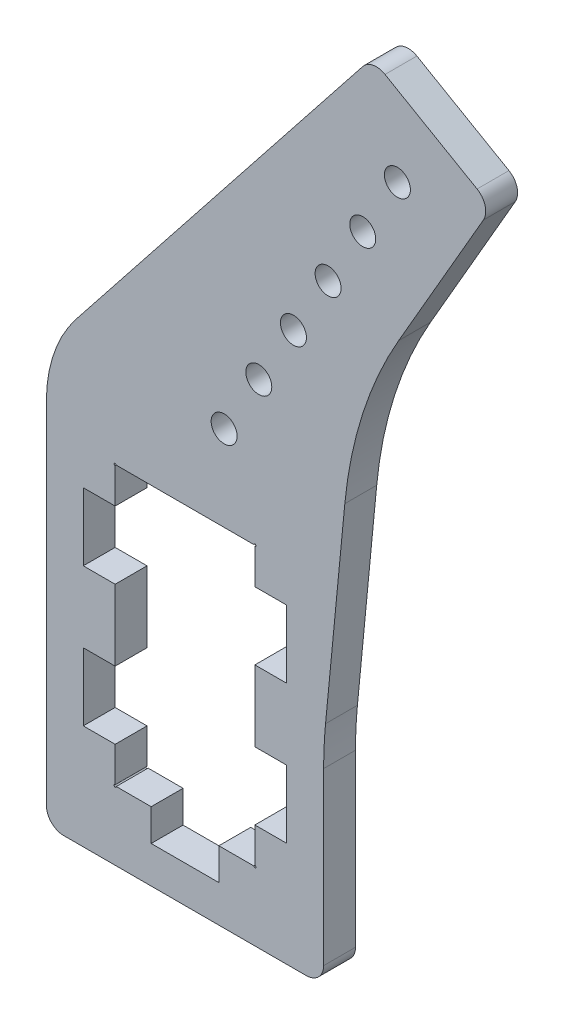
from build123d import *

# Parameters (mm, degrees)
SKETCH1_R           = 2.38125
BOSS_EXTRUDE1_DEPTH = 5.842
FILLET1_R           = 3.175
FILLET3_R           = 76.2
FILLET4_R           = 25.4
SKETCH2_R           = 0.1984375
CUT_EXTRUDE1_DEPTH  = 126.445308344


with BuildPart() as part:
    # Sketch1 → Boss-Extrude1 (new body)
    with BuildSketch(Plane.XY):
        Polygon((25.4, -38.1), (-25.4, -38.1), (-25.4, 38.1), (34.270606379, 113.488181024), (56.267651635, 100.788181024), (30.867651635, 56.794090512), (25.4, 0), align=None)
        with Locations((7.169129007, 41.147045256)):
            Circle(SKETCH1_R, mode=Mode.SUBTRACT)
        with Locations((13.519129007, 52.145567884)):
            Circle(SKETCH1_R, mode=Mode.SUBTRACT)
        with Locations((19.869129007, 63.144090512)):
            Circle(SKETCH1_R, mode=Mode.SUBTRACT)
        with Locations((26.219129007, 74.14261314)):
            Circle(SKETCH1_R, mode=Mode.SUBTRACT)
        with Locations((32.569129007, 85.141135768)):
            Circle(SKETCH1_R, mode=Mode.SUBTRACT)
        with Locations((38.919129007, 96.139658396)):
            Circle(SKETCH1_R, mode=Mode.SUBTRACT)
        Polygon((-12.800000054, -25.5), (-6.2, -25.5), (-6.2, -31.342), (6.2, -31.342), (6.2, -25.5), (12.800000054, -25.5), (12.800000054, -18.9), (18.642000054, -18.9), (18.642000054, -6.5), (12.800000054, -6.5), (12.800000054, 6.5), (18.642000054, 6.5), (18.642000054, 18.9), (12.800000054, 18.9), (12.800000054, 25.5), (-12.800000054, 25.5), (-12.800000054, 18.9), (-18.642000054, 18.9), (-18.642000054, 6.5), (-12.800000054, 6.5), (-12.800000054, -6.5), (-18.642000054, -6.5), (-18.642000054, -18.9), (-12.800000054, -18.9), align=None, mode=Mode.SUBTRACT)
    extrude(amount=BOSS_EXTRUDE1_DEPTH)

    # Fillet1
    fillet1_edges = [part.edges().sort_by_distance(p)[0] for p in [
        (34.270606379, 113.488181024, 2.921),
        (56.267651635, 100.788181024, 2.921),
        (25.4, -38.1, 2.921),
        (-25.4, -38.1, 2.921),
    ]]
    fillet(fillet1_edges, radius=FILLET1_R)

    # Fillet3
    # the kernel refuses this fillet: 76.2 mm, written as the material it adds along each edge
    with BuildSketch(Plane(origin=(30.867651635, 56.794090512, 0), x_dir=(-0.09582843425224026, -0.9953978657746682, 0), z_dir=(0, 0, 1))) as fillet3_piece_1:
        with BuildLine():
            CenterArc((FILLET3_R * 0.217130392833, FILLET3_R), FILLET3_R, 245.499003148, 24.500996852)
            Line((-FILLET3_R * 0.197578681587, FILLET3_R * 0.0900459442402), (0, 0))
            Line((0, 0), (FILLET3_R * 0.217130392833, 0))
        make_face()
    extrude(amount=5.842)
    with BuildSketch(Plane(origin=(25.4, 0, 0), x_dir=(0, -1, 0), z_dir=(0, 0, 1))) as fillet3_piece_2:
        with BuildLine():
            CenterArc((FILLET3_R * 0.048024725242, FILLET3_R), FILLET3_R, 264.500996852, 5.499003148)
            Line((-FILLET3_R * 0.0478037090103, FILLET3_R * 0.00460213422533), (0, 0))
            Line((0, 0), (FILLET3_R * 0.048024725242, 0))
        make_face()
    extrude(amount=5.842)

    # Fillet4
    fillet4_edges = [part.edges().sort_by_distance(p)[0] for p in [
        (-25.4, 38.1, 2.921),
    ]]
    fillet(fillet4_edges, radius=FILLET4_R)

    # Sketch2 → Cut-Extrude1 (cut, through all)
    with BuildSketch(Plane.XY.offset(5.842)):
        with Locations((-12.800000054, 25.5)):
            Circle(SKETCH2_R)
        with Locations((12.800000054, 25.5)):
            Circle(SKETCH2_R)
        with Locations((12.800000054, -25.5)):
            Circle(SKETCH2_R)
        with Locations((-12.800000054, -25.5)):
            Circle(SKETCH2_R)
    extrude(amount=-CUT_EXTRUDE1_DEPTH, mode=Mode.SUBTRACT)


solid = part.part
